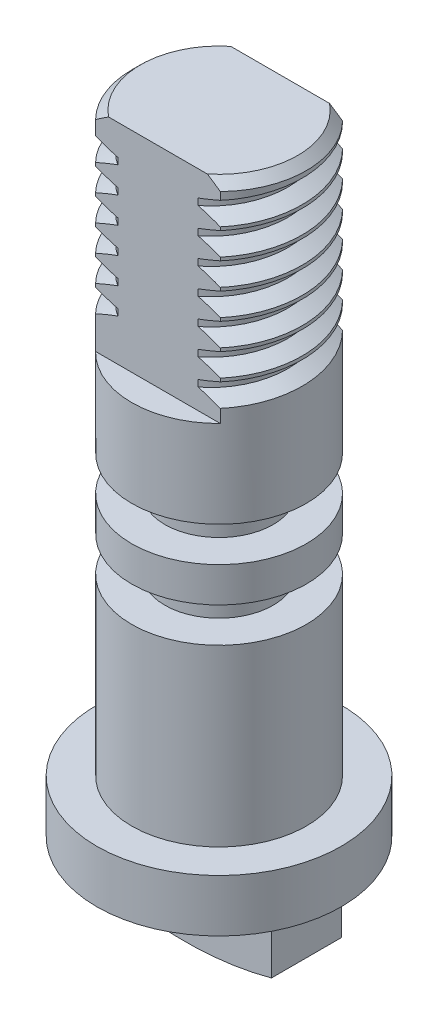
from build123d import *

# Parameters (mm, degrees)
DODANIE_WYCI_GNI_CIE2_DEPTH      = 2
DODANIE_WYCI_GNI_CIE2_DEPTH_BACK = 2
SZKIC2_R                         = 7
DODANIE_WYCI_GNI_CIE3_DEPTH      = 3
DODANIE_WYCI_GNI_CIE4_START      = -11.8
SZKIC3_R                         = 5
DODANIE_WYCI_GNI_CIE4_DEPTH      = 33
SZKIC4_W                         = 1.9
SZKIC4_H                         = 2
GWINT1_PITCH                     = 1.5
SZKIC6_W                         = 7.141428428
SZKIC6_H                         = 1.995098794
SZKIC6_H_2                       = 2.248011291
WYTNIJ_WYCI_GNI_CIE1_DEPTH       = 12
SFAZOWANIE1_SIZE                 = 0.5


with BuildPart() as part:
    # Szkic1 → Dodanie-wyciągnięcie2 (new, two sides: drawn at the far end of the back side and taken through both)
    with BuildSketch(Plane.XY.offset(-DODANIE_WYCI_GNI_CIE2_DEPTH_BACK)):
        with BuildLine():
            Line((-5, -18.33030278), (-5, -14.8))
            Line((-5, -14.8), (5, -14.8))
            Line((5, -14.8), (5, -18.33030278))
            ThreePointArc((5, -18.33030278), (0, -19), (-5, -18.33030278))
        make_face()
    extrude(amount=DODANIE_WYCI_GNI_CIE2_DEPTH + DODANIE_WYCI_GNI_CIE2_DEPTH_BACK)

    # Szkic2 → Dodanie-wyciągnięcie3 (add)
    with BuildSketch(Plane(origin=(0, -14.8, 0), x_dir=(1, 0, 0), z_dir=(0, 1, 0))):
        with Locations(Location((0, 0, 0), (0, 0, 270))):
            Circle(SZKIC2_R)
    extrude(amount=DODANIE_WYCI_GNI_CIE3_DEPTH)


with BuildPart() as body_2:
    # Szkic3 → Dodanie-wyciągnięcie4 (new body)
    with BuildSketch(Plane(origin=(0, 0, 0), x_dir=(1, 0, 0), z_dir=(0, 1, 0)).offset(DODANIE_WYCI_GNI_CIE4_START)):
        with Locations(Location((0, 0, 0), (0, 0, 270))):
            Circle(SZKIC3_R)
    extrude(amount=DODANIE_WYCI_GNI_CIE4_DEPTH)

    # Szkic4 → Wycięcie-obrót3 (revolve, cut)
    with BuildSketch(Plane.XY, mode=Mode.PRIVATE) as wyci_cie_obr_t3_sk:
        with Locations((-4.05, -0.8)):
            Rectangle(SZKIC4_W, SZKIC4_H)
        with Locations((-4.05, 3.2)):
            Rectangle(SZKIC4_W, SZKIC4_H)
    revolve(wyci_cie_obr_t3_sk.sketch.rotate(Axis((0, 20.954632119, 0), (0, -1, 0)), 270), axis=Axis((0, 20.954632119, 0), (0, -1, 0)), mode=Mode.SUBTRACT)

    # Gwint1: the profile of Profil gwintu1 profile screwed along a right-hand helix of 6.666667 turns, 8 arcs to a turn; built about Z, then put on its axis
    gwint1_z = Axis((0, 0, 0), (0, 0, 1))
    gwint1_corners = [(5.0003, 0, -0.000173205), (5.0003, 0, 1.312673201), (4.188101188, 0, 0.843749998), (4.188101188, 0, 0.468749998)]
    with BuildLine(mode=Mode.PRIVATE) as gwint1_profile:
        Line(gwint1_corners[0], gwint1_corners[1])
        Line(gwint1_corners[1], gwint1_corners[2])
        Line(gwint1_corners[2], gwint1_corners[3])
        Line(gwint1_corners[3], gwint1_corners[0])
    gwint1_cap = Face(gwint1_profile.wire())
    gwint1_turn_angles = [0, 22.5, 45, 67.5, 90, 112.5, 135, 157.5, 180, 202.5, 225, 247.5, 270, 292.5, 315, 337.5, 360]
    gwint1_turn_weights = [1, 0.9238795325112867, 1, 0.9238795325112867, 1, 0.9238795325112867, 1, 0.9238795325112867, 1, 0.9238795325112867, 1, 0.9238795325112867, 1, 0.9238795325112867, 1, 0.9238795325112867, 1]
    gwint1_turn_rails = [Edge.make_bspline([Vector(p[0], p[1], 0).rotate(gwint1_z, gwint1_turn_angles[k]) / gwint1_turn_weights[k] + Vector(0, 0, p[2] + GWINT1_PITCH * gwint1_turn_angles[k] / 360) for k in range(17)], [0, 0, 0, 1, 1, 2, 2, 3, 3, 4, 4, 5, 5, 6, 6, 7, 7, 8, 8, 8], 2, gwint1_turn_weights) for p in gwint1_corners]
    gwint1_turn_sides = [Face.make_surface_from_curves(gwint1_turn_rails[p[0]], gwint1_turn_rails[p[1]]) for p in [(0, 1), (1, 2), (2, 3), (3, 0)]]
    gwint1_last_angles = [2160, 2182.5, 2205, 2227.5, 2250, 2272.5, 2295, 2317.5, 2340, 2362.5, 2385, 2392.5, 2400]
    gwint1_last_weights = [1, 0.9238795325112867, 1, 0.9238795325112867, 1, 0.9238795325112867, 1, 0.9238795325112867, 1, 0.9238795325112867, 1, 0.9914448613738109, 1]
    gwint1_last_rails = [Edge.make_bspline([Vector(p[0], p[1], 0).rotate(gwint1_z, gwint1_last_angles[k]) / gwint1_last_weights[k] + Vector(0, 0, p[2] + GWINT1_PITCH * gwint1_last_angles[k] / 360) for k in range(13)], [0, 0, 0, 1, 1, 2, 2, 3, 3, 4, 4, 5, 5, 6, 6, 6], 2, gwint1_last_weights) for p in gwint1_corners]
    gwint1_last_sides = [Face.make_surface_from_curves(gwint1_last_rails[p[0]], gwint1_last_rails[p[1]]) for p in [(0, 1), (1, 2), (2, 3), (3, 0)]]
    gwint1 = Plane(origin=(0, 21.2, 0), x_dir=(-1, 0, 0), z_dir=(0, -1, 0)) * Solid(Shell([*[p.moved(Location((0, 0, GWINT1_PITCH * i))) for i in range(6) for p in gwint1_turn_sides], *gwint1_last_sides, gwint1_cap, gwint1_cap.rotate(gwint1_z, 2400).moved(Location((0, 0, GWINT1_PITCH * 2400 / 360)))]))
    add(gwint1, mode=Mode.SUBTRACT)

    # Szkic6 → Wytnij-wyciągnięcie1 (cut)
    with BuildSketch(Plane(origin=(0, 21.2, 0), x_dir=(1, 0, 0), z_dir=(0, 1, 0))):
        with Locations((0, 4.497549397)):
            Rectangle(SZKIC6_W, SZKIC6_H)
        with Locations((0, -4.624005646)):
            Rectangle(SZKIC6_W, SZKIC6_H_2)
    extrude(amount=-WYTNIJ_WYCI_GNI_CIE1_DEPTH, mode=Mode.SUBTRACT)

    # Sfazowanie1
    # the kernel refuses this chamfer: 0.5 mm, written as the material it takes off along each edge
    with BuildSketch(Plane(origin=(0, 21.2, 0), x_dir=(0.5125310406893024, 0, 0.8586686976534901), z_dir=(-0.8586686976534901, 0, 0.5125310406893024))) as sfazowanie1_piece_1:
        Polygon((5 - SFAZOWANIE1_SIZE, 0), (5, -SFAZOWANIE1_SIZE), (5, 0), align=None)
    revolve(axis=Axis((0, 21.2, 0), (0, 1, 0)), revolution_arc=118.334862721, mode=Mode.SUBTRACT)
    with BuildSketch(Plane(origin=(0, 21.2, 0), x_dir=(-0.5125958893291196, 0, -0.8586299868062429), z_dir=(0.8586299868062429, 0, -0.5125958893291196))) as sfazowanie1_piece_2:
        Polygon((5 - SFAZOWANIE1_SIZE, 0), (5, -SFAZOWANIE1_SIZE), (5, 0), align=None)
    revolve(axis=Axis((0, 21.2, 0), (0, 1, 0)), revolution_arc=59.163104154, mode=Mode.SUBTRACT)
    with BuildSketch(Plane(origin=(0, 21.2, 0), x_dir=(-1, 0, 0), z_dir=(0, 0, -1))) as sfazowanie1_piece_3:
        Polygon((5 - SFAZOWANIE1_SIZE, 0), (5, -SFAZOWANIE1_SIZE), (5, 0), align=None)
    revolve(axis=Axis((0, 21.2, 0), (0, 1, 0)), revolution_arc=59.163104154, mode=Mode.SUBTRACT)


solid = Compound([part.part, body_2.part])
